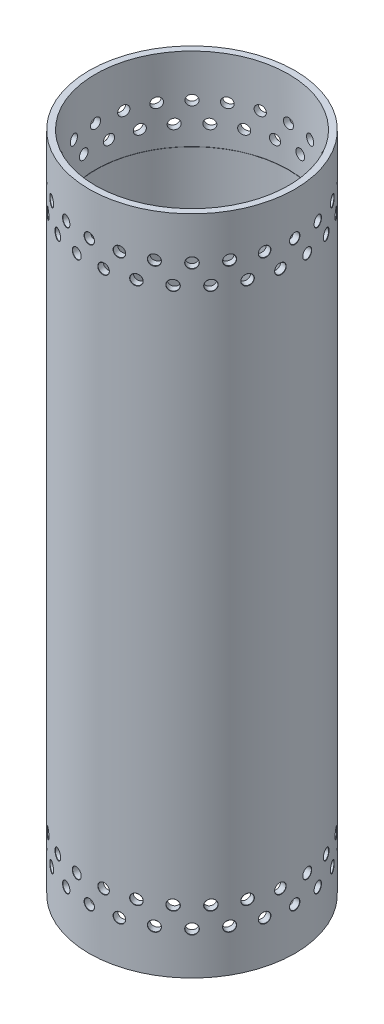
from build123d import *

# Parameters (mm, degrees)
SZKIC1_R                    = 90
SZKIC1_R_2                  = 81.5
DODANIE_WYCI_GNI_CIE1_DEPTH = 560
SZKIC2_R                    = 90
SZKIC2_R_2                  = 87
WYTNIJ_WYCI_GNI_CIE1_DEPTH  = 575.282160614
WYTNIJ_WYCI_GNI_CIE2_START  = -70
SZKIC3_R                    = 81.7
SZKIC3_R_2                  = 81.5
WYTNIJ_WYCI_GNI_CIE2_DEPTH  = 70
SZYK_KO_OWY1_COUNT          = 24


with BuildPart() as part:
    # Szkic1 → Dodanie-wyciągnięcie1 (new body)
    with BuildSketch(Plane(origin=(0, 0, 0), x_dir=(1, 0, 0), z_dir=(0, 1, 0))):
        with Locations(Location((0, 0, 0), (0, 0, 270))):
            Circle(SZKIC1_R)
        with Locations(Location((0, 0, 0), (0, 0, 270))):
            Circle(SZKIC1_R_2, mode=Mode.SUBTRACT)
    extrude(amount=DODANIE_WYCI_GNI_CIE1_DEPTH)

    # Szkic2 → Wytnij-wyciągnięcie1 (cut, through all)
    with BuildSketch(Plane(origin=(0, 560, 0), x_dir=(1, 0, 0), z_dir=(0, 1, 0))):
        Circle(SZKIC2_R)
        with Locations(Location((0, 0, 0), (0, 0, 270))):
            Circle(SZKIC2_R_2, mode=Mode.SUBTRACT)
    extrude(amount=-WYTNIJ_WYCI_GNI_CIE1_DEPTH, mode=Mode.SUBTRACT)

    # Szkic3 → Wytnij-wyciągnięcie2 (cut)
    with BuildSketch(Plane(origin=(0, 560, 0), x_dir=(1, 0, 0), z_dir=(0, 1, 0)).offset(WYTNIJ_WYCI_GNI_CIE2_START)):
        with Locations(Location((0, 0, 0), (0, 0, 270))):
            Circle(SZKIC3_R)
        with Locations(Location((0, 0, 0), (0, 0, 270))):
            Circle(SZKIC3_R_2, mode=Mode.SUBTRACT)
    wytnij_wyci_gni_cie2 = extrude(amount=WYTNIJ_WYCI_GNI_CIE2_DEPTH, mode=Mode.SUBTRACT)

    # Otwór Ø8.5 (8.5)1: read off the stored shape, not the designer's step
    # Otwór Ø8.5 (8.5)1 outline → Otwór Ø8.5 (8.5)1 (revolve, cut)
    with BuildSketch(Plane.XZ.offset(-524)):
        Polygon((0, 81.589336122), (4.25, 81.589336122), (4.25, 86.75), (4.500000084, 87.000000084), (0, 87.000000084), align=None)
    otw_r_8_5_8_5_1 = revolve(axis=Axis((0, 524, 0), (0, 0, 1)), mode=Mode.SUBTRACT)

    # Otwór Ø8.5 (8.5)2: read off the stored shape, not the designer's step
    # Otwór Ø8.5 (8.5)2 outline → Otwór Ø8.5 (8.5)2 (revolve, cut)
    with BuildSketch(Plane(origin=(0, 507, 0), x_dir=(0.9914448613738103, 0, -0.13052619222005205), z_dir=(0, -1, 0))):
        Polygon((0, 81.589323977), (4.25, 81.589323977), (4.25, 86.75), (4.500063259, 87.000063259), (0, 87.000063259), align=None)
    otw_r_8_5_8_5_2 = revolve(axis=Axis((0, 507, 0), (0.13052619222005205, 0, 0.9914448613738103)), mode=Mode.SUBTRACT)

    # Szyk kołowy1: Otwór Ø8.5 (8.5)1, Otwór Ø8.5 (8.5)2 ×24 about axis
    szyk_ko_owy1_axis = Axis((0, 0, 0), (0, 1, 0))
    add([otw_r_8_5_8_5_1.rotate(szyk_ko_owy1_axis, i * 360 / SZYK_KO_OWY1_COUNT) for i in range(1, SZYK_KO_OWY1_COUNT)], mode=Mode.SUBTRACT)
    add([otw_r_8_5_8_5_2.rotate(szyk_ko_owy1_axis, i * 360 / SZYK_KO_OWY1_COUNT) for i in range(1, SZYK_KO_OWY1_COUNT)], mode=Mode.SUBTRACT)

    # Lustro1: Wytnij-wyciągnięcie2, Otwór Ø8.5 (8.5)1, Otwór Ø8.5 (8.5)2 across plane
    add(wytnij_wyci_gni_cie2.mirror(Plane.ZX.offset(280)), mode=Mode.SUBTRACT)
    add(otw_r_8_5_8_5_1.mirror(Plane.ZX.offset(280)), mode=Mode.SUBTRACT)
    add(otw_r_8_5_8_5_2.mirror(Plane.ZX.offset(280)), mode=Mode.SUBTRACT)

    # Lustro1 copy 1 sketch → Lustro1 copy 1 (revolve, cut)
    with BuildSketch(Plane(origin=(0, 36, 0), x_dir=(0.9659258262890683, 0, -0.25881904510252074), z_dir=(0, 1, 0))):
        Polygon((0, -81.589336122), (4.25, -81.589336122), (4.25, -86.75), (4.500000084, -87.000000084), (0, -87.000000084), align=None)
    revolve(axis=Axis((0, 36, 0), (-0.25881904510252074, 0, -0.9659258262890683)), mode=Mode.SUBTRACT)

    # Lustro1 copy 2 sketch → Lustro1 copy 2 (revolve, cut)
    with BuildSketch(Plane(origin=(0, 36, 0), x_dir=(0.8660254037844387, 0, -0.49999999999999994), z_dir=(0, 1, 0))):
        Polygon((0, -81.589336122), (4.25, -81.589336122), (4.25, -86.75), (4.500000084, -87.000000084), (0, -87.000000084), align=None)
    revolve(axis=Axis((0, 36, 0), (-0.49999999999999994, 0, -0.8660254037844387)), mode=Mode.SUBTRACT)

    # Lustro1 copy 3 sketch → Lustro1 copy 3 (revolve, cut)
    with BuildSketch(Plane(origin=(0, 36, 0), x_dir=(0.7071067811865476, 0, -0.7071067811865475), z_dir=(0, 1, 0))):
        Polygon((0, -81.589336122), (4.25, -81.589336122), (4.25, -86.75), (4.500000084, -87.000000084), (0, -87.000000084), align=None)
    revolve(axis=Axis((0, 36, 0), (-0.7071067811865475, 0, -0.7071067811865476)), mode=Mode.SUBTRACT)

    # Lustro1 copy 4 sketch → Lustro1 copy 4 (revolve, cut)
    with BuildSketch(Plane(origin=(0, 36, 0), x_dir=(0.5000000000000001, 0, -0.8660254037844386), z_dir=(0, 1, 0))):
        Polygon((0, -81.589336122), (4.25, -81.589336122), (4.25, -86.75), (4.500000084, -87.000000084), (0, -87.000000084), align=None)
    revolve(axis=Axis((0, 36, 0), (-0.8660254037844386, 0, -0.5000000000000001)), mode=Mode.SUBTRACT)

    # Lustro1 copy 5 sketch → Lustro1 copy 5 (revolve, cut)
    with BuildSketch(Plane(origin=(0, 36, 0), x_dir=(0.25881904510252074, 0, -0.9659258262890683), z_dir=(0, 1, 0))):
        Polygon((0, -81.589336122), (4.25, -81.589336122), (4.25, -86.75), (4.500000084, -87.000000084), (0, -87.000000084), align=None)
    revolve(axis=Axis((0, 36, 0), (-0.9659258262890683, 0, -0.25881904510252074)), mode=Mode.SUBTRACT)

    # Lustro1 copy 6 sketch → Lustro1 copy 6 (revolve, cut)
    with BuildSketch(Plane(origin=(0, 36, 0), x_dir=(0, 0, -1), z_dir=(0, 1, 0))):
        Polygon((0, -81.589336122), (4.25, -81.589336122), (4.25, -86.75), (4.500000084, -87.000000084), (0, -87.000000084), align=None)
    revolve(axis=Axis((0, 36, 0), (-1, 0, 0)), mode=Mode.SUBTRACT)

    # Lustro1 copy 7 sketch → Lustro1 copy 7 (revolve, cut)
    with BuildSketch(Plane(origin=(0, 36, 0), x_dir=(-0.25881904510252085, 0, -0.9659258262890683), z_dir=(0, 1, 0))):
        Polygon((0, -81.589336122), (4.25, -81.589336122), (4.25, -86.75), (4.500000084, -87.000000084), (0, -87.000000084), align=None)
    revolve(axis=Axis((0, 36, 0), (-0.9659258262890683, 0, 0.25881904510252085)), mode=Mode.SUBTRACT)

    # Lustro1 copy 8 sketch → Lustro1 copy 8 (revolve, cut)
    with BuildSketch(Plane(origin=(0, 36, 0), x_dir=(-0.4999999999999998, 0, -0.8660254037844387), z_dir=(0, 1, 0))):
        Polygon((0, -81.589336122), (4.25, -81.589336122), (4.25, -86.75), (4.500000084, -87.000000084), (0, -87.000000084), align=None)
    revolve(axis=Axis((0, 36, 0), (-0.8660254037844387, 0, 0.4999999999999998)), mode=Mode.SUBTRACT)

    # Lustro1 copy 9 sketch → Lustro1 copy 9 (revolve, cut)
    with BuildSketch(Plane(origin=(0, 36, 0), x_dir=(-0.7071067811865475, 0, -0.7071067811865476), z_dir=(0, 1, 0))):
        Polygon((0, -81.589336122), (4.25, -81.589336122), (4.25, -86.75), (4.500000084, -87.000000084), (0, -87.000000084), align=None)
    revolve(axis=Axis((0, 36, 0), (-0.7071067811865476, 0, 0.7071067811865475)), mode=Mode.SUBTRACT)

    # Lustro1 copy 10 sketch → Lustro1 copy 10 (revolve, cut)
    with BuildSketch(Plane(origin=(0, 36, 0), x_dir=(-0.8660254037844387, 0, -0.49999999999999994), z_dir=(0, 1, 0))):
        Polygon((0, -81.589336122), (4.25, -81.589336122), (4.25, -86.75), (4.500000084, -87.000000084), (0, -87.000000084), align=None)
    revolve(axis=Axis((0, 36, 0), (-0.49999999999999994, 0, 0.8660254037844387)), mode=Mode.SUBTRACT)

    # Lustro1 copy 11 sketch → Lustro1 copy 11 (revolve, cut)
    with BuildSketch(Plane(origin=(0, 36, 0), x_dir=(-0.9659258262890682, 0, -0.258819045102521), z_dir=(0, 1, 0))):
        Polygon((0, -81.589336122), (4.25, -81.589336122), (4.25, -86.75), (4.500000084, -87.000000084), (0, -87.000000084), align=None)
    revolve(axis=Axis((0, 36, 0), (-0.258819045102521, 0, 0.9659258262890682)), mode=Mode.SUBTRACT)

    # Lustro1 copy 12 sketch → Lustro1 copy 12 (revolve, cut)
    with BuildSketch(Plane(origin=(0, 36, 0), x_dir=(-1, 0, 0), z_dir=(0, 1, 0))):
        Polygon((0, -81.589336122), (4.25, -81.589336122), (4.25, -86.75), (4.500000084, -87.000000084), (0, -87.000000084), align=None)
    revolve(axis=Axis((0, 36, 0), (0, 0, 1)), mode=Mode.SUBTRACT)

    # Lustro1 copy 13 sketch → Lustro1 copy 13 (revolve, cut)
    with BuildSketch(Plane(origin=(0, 36, 0), x_dir=(-0.9659258262890683, 0, 0.2588190451025208), z_dir=(0, 1, 0))):
        Polygon((0, -81.589336122), (4.25, -81.589336122), (4.25, -86.75), (4.500000084, -87.000000084), (0, -87.000000084), align=None)
    revolve(axis=Axis((0, 36, 0), (0.2588190451025208, 0, 0.9659258262890683)), mode=Mode.SUBTRACT)

    # Lustro1 copy 14 sketch → Lustro1 copy 14 (revolve, cut)
    with BuildSketch(Plane(origin=(0, 36, 0), x_dir=(-0.8660254037844386, 0, 0.5000000000000001), z_dir=(0, 1, 0))):
        Polygon((0, -81.589336122), (4.25, -81.589336122), (4.25, -86.75), (4.500000084, -87.000000084), (0, -87.000000084), align=None)
    revolve(axis=Axis((0, 36, 0), (0.5000000000000001, 0, 0.8660254037844386)), mode=Mode.SUBTRACT)

    # Lustro1 copy 15 sketch → Lustro1 copy 15 (revolve, cut)
    with BuildSketch(Plane(origin=(0, 36, 0), x_dir=(-0.7071067811865477, 0, 0.7071067811865475), z_dir=(0, 1, 0))):
        Polygon((0, -81.589336122), (4.25, -81.589336122), (4.25, -86.75), (4.500000084, -87.000000084), (0, -87.000000084), align=None)
    revolve(axis=Axis((0, 36, 0), (0.7071067811865475, 0, 0.7071067811865477)), mode=Mode.SUBTRACT)

    # Lustro1 copy 16 sketch → Lustro1 copy 16 (revolve, cut)
    with BuildSketch(Plane(origin=(0, 36, 0), x_dir=(-0.5000000000000004, 0, 0.8660254037844384), z_dir=(0, 1, 0))):
        Polygon((0, -81.589336122), (4.25, -81.589336122), (4.25, -86.75), (4.500000084, -87.000000084), (0, -87.000000084), align=None)
    revolve(axis=Axis((0, 36, 0), (0.8660254037844384, 0, 0.5000000000000004)), mode=Mode.SUBTRACT)

    # Lustro1 copy 17 sketch → Lustro1 copy 17 (revolve, cut)
    with BuildSketch(Plane(origin=(0, 36, 0), x_dir=(-0.25881904510252063, 0, 0.9659258262890683), z_dir=(0, 1, 0))):
        Polygon((0, -81.589336122), (4.25, -81.589336122), (4.25, -86.75), (4.500000084, -87.000000084), (0, -87.000000084), align=None)
    revolve(axis=Axis((0, 36, 0), (0.9659258262890683, 0, 0.25881904510252063)), mode=Mode.SUBTRACT)

    # Lustro1 copy 18 sketch → Lustro1 copy 18 (revolve, cut)
    with BuildSketch(Plane.ZX.offset(36)):
        Polygon((0, -81.589336122), (4.25, -81.589336122), (4.25, -86.75), (4.500000084, -87.000000084), (0, -87.000000084), align=None)
    revolve(axis=Axis((0, 36, 0), (1, 0, 0)), mode=Mode.SUBTRACT)

    # Lustro1 copy 19 sketch → Lustro1 copy 19 (revolve, cut)
    with BuildSketch(Plane(origin=(0, 36, 0), x_dir=(0.2588190451025203, 0, 0.9659258262890684), z_dir=(0, 1, 0))):
        Polygon((0, -81.589336122), (4.25, -81.589336122), (4.25, -86.75), (4.500000084, -87.000000084), (0, -87.000000084), align=None)
    revolve(axis=Axis((0, 36, 0), (0.9659258262890684, 0, -0.2588190451025203)), mode=Mode.SUBTRACT)

    # Lustro1 copy 20 sketch → Lustro1 copy 20 (revolve, cut)
    with BuildSketch(Plane(origin=(0, 36, 0), x_dir=(0.5000000000000001, 0, 0.8660254037844386), z_dir=(0, 1, 0))):
        Polygon((0, -81.589336122), (4.25, -81.589336122), (4.25, -86.75), (4.500000084, -87.000000084), (0, -87.000000084), align=None)
    revolve(axis=Axis((0, 36, 0), (0.8660254037844386, 0, -0.5000000000000001)), mode=Mode.SUBTRACT)

    # Lustro1 copy 21 sketch → Lustro1 copy 21 (revolve, cut)
    with BuildSketch(Plane(origin=(0, 36, 0), x_dir=(0.7071067811865474, 0, 0.7071067811865477), z_dir=(0, 1, 0))):
        Polygon((0, -81.589336122), (4.25, -81.589336122), (4.25, -86.75), (4.500000084, -87.000000084), (0, -87.000000084), align=None)
    revolve(axis=Axis((0, 36, 0), (0.7071067811865477, 0, -0.7071067811865474)), mode=Mode.SUBTRACT)

    # Lustro1 copy 22 sketch → Lustro1 copy 22 (revolve, cut)
    with BuildSketch(Plane(origin=(0, 36, 0), x_dir=(0.8660254037844384, 0, 0.5000000000000004), z_dir=(0, 1, 0))):
        Polygon((0, -81.589336122), (4.25, -81.589336122), (4.25, -86.75), (4.500000084, -87.000000084), (0, -87.000000084), align=None)
    revolve(axis=Axis((0, 36, 0), (0.5000000000000004, 0, -0.8660254037844384)), mode=Mode.SUBTRACT)

    # Lustro1 copy 23 sketch → Lustro1 copy 23 (revolve, cut)
    with BuildSketch(Plane(origin=(0, 36, 0), x_dir=(0.9659258262890683, 0, 0.2588190451025207), z_dir=(0, 1, 0))):
        Polygon((0, -81.589336122), (4.25, -81.589336122), (4.25, -86.75), (4.500000084, -87.000000084), (0, -87.000000084), align=None)
    revolve(axis=Axis((0, 36, 0), (0.2588190451025207, 0, -0.9659258262890683)), mode=Mode.SUBTRACT)

    # Lustro1 copy 24 sketch → Lustro1 copy 24 (revolve, cut)
    with BuildSketch(Plane(origin=(0, 53, 0), x_dir=(0.9238795325112865, 0, -0.38268343236509017), z_dir=(0, 1, 0))):
        Polygon((0, -81.589323977), (4.25, -81.589323977), (4.25, -86.75), (4.500063259, -87.000063259), (0, -87.000063259), align=None)
    revolve(axis=Axis((0, 53, 0), (-0.38268343236509017, 0, -0.9238795325112865)), mode=Mode.SUBTRACT)

    # Lustro1 copy 25 sketch → Lustro1 copy 25 (revolve, cut)
    with BuildSketch(Plane(origin=(0, 53, 0), x_dir=(0.7933533402912349, 0, -0.6087614290087209), z_dir=(0, 1, 0))):
        Polygon((0, -81.589323977), (4.25, -81.589323977), (4.25, -86.75), (4.500063259, -87.000063259), (0, -87.000063259), align=None)
    revolve(axis=Axis((0, 53, 0), (-0.6087614290087209, 0, -0.7933533402912349)), mode=Mode.SUBTRACT)

    # Lustro1 copy 26 sketch → Lustro1 copy 26 (revolve, cut)
    with BuildSketch(Plane(origin=(0, 53, 0), x_dir=(0.6087614290087202, 0, -0.7933533402912353), z_dir=(0, 1, 0))):
        Polygon((0, -81.589323977), (4.25, -81.589323977), (4.25, -86.75), (4.500063259, -87.000063259), (0, -87.000063259), align=None)
    revolve(axis=Axis((0, 53, 0), (-0.7933533402912353, 0, -0.6087614290087202)), mode=Mode.SUBTRACT)

    # Lustro1 copy 27 sketch → Lustro1 copy 27 (revolve, cut)
    with BuildSketch(Plane(origin=(0, 53, 0), x_dir=(0.3826834323650894, 0, -0.9238795325112868), z_dir=(0, 1, 0))):
        Polygon((0, -81.589323977), (4.25, -81.589323977), (4.25, -86.75), (4.500063259, -87.000063259), (0, -87.000063259), align=None)
    revolve(axis=Axis((0, 53, 0), (-0.9238795325112868, 0, -0.3826834323650894)), mode=Mode.SUBTRACT)

    # Lustro1 copy 28 sketch → Lustro1 copy 28 (revolve, cut)
    with BuildSketch(Plane(origin=(0, 53, 0), x_dir=(0.13052619222005113, 0, -0.9914448613738105), z_dir=(0, 1, 0))):
        Polygon((0, -81.589323977), (4.25, -81.589323977), (4.25, -86.75), (4.500063259, -87.000063259), (0, -87.000063259), align=None)
    revolve(axis=Axis((0, 53, 0), (-0.9914448613738105, 0, -0.13052619222005113)), mode=Mode.SUBTRACT)

    # Lustro1 copy 29 sketch → Lustro1 copy 29 (revolve, cut)
    with BuildSketch(Plane(origin=(0, 53, 0), x_dir=(-0.130526192220052, 0, -0.9914448613738103), z_dir=(0, 1, 0))):
        Polygon((0, -81.589323977), (4.25, -81.589323977), (4.25, -86.75), (4.500063259, -87.000063259), (0, -87.000063259), align=None)
    revolve(axis=Axis((0, 53, 0), (-0.9914448613738103, 0, 0.130526192220052)), mode=Mode.SUBTRACT)

    # Lustro1 copy 30 sketch → Lustro1 copy 30 (revolve, cut)
    with BuildSketch(Plane(origin=(0, 53, 0), x_dir=(-0.3826834323650902, 0, -0.9238795325112865), z_dir=(0, 1, 0))):
        Polygon((0, -81.589323977), (4.25, -81.589323977), (4.25, -86.75), (4.500063259, -87.000063259), (0, -87.000063259), align=None)
    revolve(axis=Axis((0, 53, 0), (-0.9238795325112865, 0, 0.3826834323650902)), mode=Mode.SUBTRACT)

    # Lustro1 copy 31 sketch → Lustro1 copy 31 (revolve, cut)
    with BuildSketch(Plane(origin=(0, 53, 0), x_dir=(-0.6087614290087208, 0, -0.7933533402912349), z_dir=(0, 1, 0))):
        Polygon((0, -81.589323977), (4.25, -81.589323977), (4.25, -86.75), (4.500063259, -87.000063259), (0, -87.000063259), align=None)
    revolve(axis=Axis((0, 53, 0), (-0.7933533402912349, 0, 0.6087614290087208)), mode=Mode.SUBTRACT)

    # Lustro1 copy 32 sketch → Lustro1 copy 32 (revolve, cut)
    with BuildSketch(Plane(origin=(0, 53, 0), x_dir=(-0.7933533402912353, 0, -0.6087614290087202), z_dir=(0, 1, 0))):
        Polygon((0, -81.589323977), (4.25, -81.589323977), (4.25, -86.75), (4.500063259, -87.000063259), (0, -87.000063259), align=None)
    revolve(axis=Axis((0, 53, 0), (-0.6087614290087202, 0, 0.7933533402912353)), mode=Mode.SUBTRACT)

    # Lustro1 copy 33 sketch → Lustro1 copy 33 (revolve, cut)
    with BuildSketch(Plane(origin=(0, 53, 0), x_dir=(-0.923879532511287, 0, -0.3826834323650892), z_dir=(0, 1, 0))):
        Polygon((0, -81.589323977), (4.25, -81.589323977), (4.25, -86.75), (4.500063259, -87.000063259), (0, -87.000063259), align=None)
    revolve(axis=Axis((0, 53, 0), (-0.3826834323650892, 0, 0.923879532511287)), mode=Mode.SUBTRACT)

    # Lustro1 copy 34 sketch → Lustro1 copy 34 (revolve, cut)
    with BuildSketch(Plane(origin=(0, 53, 0), x_dir=(-0.9914448613738104, 0, -0.13052619222005135), z_dir=(0, 1, 0))):
        Polygon((0, -81.589323977), (4.25, -81.589323977), (4.25, -86.75), (4.500063259, -87.000063259), (0, -87.000063259), align=None)
    revolve(axis=Axis((0, 53, 0), (-0.13052619222005135, 0, 0.9914448613738104)), mode=Mode.SUBTRACT)

    # Lustro1 copy 35 sketch → Lustro1 copy 35 (revolve, cut)
    with BuildSketch(Plane(origin=(0, 53, 0), x_dir=(-0.9914448613738103, 0, 0.13052619222005193), z_dir=(0, 1, 0))):
        Polygon((0, -81.589323977), (4.25, -81.589323977), (4.25, -86.75), (4.500063259, -87.000063259), (0, -87.000063259), align=None)
    revolve(axis=Axis((0, 53, 0), (0.13052619222005193, 0, 0.9914448613738103)), mode=Mode.SUBTRACT)

    # Lustro1 copy 36 sketch → Lustro1 copy 36 (revolve, cut)
    with BuildSketch(Plane(origin=(0, 53, 0), x_dir=(-0.9238795325112865, 0, 0.3826834323650902), z_dir=(0, 1, 0))):
        Polygon((0, -81.589323977), (4.25, -81.589323977), (4.25, -86.75), (4.500063259, -87.000063259), (0, -87.000063259), align=None)
    revolve(axis=Axis((0, 53, 0), (0.3826834323650902, 0, 0.9238795325112865)), mode=Mode.SUBTRACT)

    # Lustro1 copy 37 sketch → Lustro1 copy 37 (revolve, cut)
    with BuildSketch(Plane(origin=(0, 53, 0), x_dir=(-0.7933533402912348, 0, 0.6087614290087211), z_dir=(0, 1, 0))):
        Polygon((0, -81.589323977), (4.25, -81.589323977), (4.25, -86.75), (4.500063259, -87.000063259), (0, -87.000063259), align=None)
    revolve(axis=Axis((0, 53, 0), (0.6087614290087211, 0, 0.7933533402912348)), mode=Mode.SUBTRACT)

    # Lustro1 copy 38 sketch → Lustro1 copy 38 (revolve, cut)
    with BuildSketch(Plane(origin=(0, 53, 0), x_dir=(-0.6087614290087203, 0, 0.7933533402912353), z_dir=(0, 1, 0))):
        Polygon((0, -81.589323977), (4.25, -81.589323977), (4.25, -86.75), (4.500063259, -87.000063259), (0, -87.000063259), align=None)
    revolve(axis=Axis((0, 53, 0), (0.7933533402912353, 0, 0.6087614290087203)), mode=Mode.SUBTRACT)

    # Lustro1 copy 39 sketch → Lustro1 copy 39 (revolve, cut)
    with BuildSketch(Plane(origin=(0, 53, 0), x_dir=(-0.3826834323650898, 0, 0.9238795325112867), z_dir=(0, 1, 0))):
        Polygon((0, -81.589323977), (4.25, -81.589323977), (4.25, -86.75), (4.500063259, -87.000063259), (0, -87.000063259), align=None)
    revolve(axis=Axis((0, 53, 0), (0.9238795325112867, 0, 0.3826834323650898)), mode=Mode.SUBTRACT)

    # Lustro1 copy 40 sketch → Lustro1 copy 40 (revolve, cut)
    with BuildSketch(Plane(origin=(0, 53, 0), x_dir=(-0.13052619222005102, 0, 0.9914448613738104), z_dir=(0, 1, 0))):
        Polygon((0, -81.589323977), (4.25, -81.589323977), (4.25, -86.75), (4.500063259, -87.000063259), (0, -87.000063259), align=None)
    revolve(axis=Axis((0, 53, 0), (0.9914448613738104, 0, 0.13052619222005102)), mode=Mode.SUBTRACT)

    # Lustro1 copy 41 sketch → Lustro1 copy 41 (revolve, cut)
    with BuildSketch(Plane(origin=(0, 53, 0), x_dir=(0.13052619222005185, 0, 0.9914448613738103), z_dir=(0, 1, 0))):
        Polygon((0, -81.589323977), (4.25, -81.589323977), (4.25, -86.75), (4.500063259, -87.000063259), (0, -87.000063259), align=None)
    revolve(axis=Axis((0, 53, 0), (0.9914448613738103, 0, -0.13052619222005185)), mode=Mode.SUBTRACT)

    # Lustro1 copy 42 sketch → Lustro1 copy 42 (revolve, cut)
    with BuildSketch(Plane(origin=(0, 53, 0), x_dir=(0.3826834323650897, 0, 0.9238795325112867), z_dir=(0, 1, 0))):
        Polygon((0, -81.589323977), (4.25, -81.589323977), (4.25, -86.75), (4.500063259, -87.000063259), (0, -87.000063259), align=None)
    revolve(axis=Axis((0, 53, 0), (0.9238795325112867, 0, -0.3826834323650897)), mode=Mode.SUBTRACT)

    # Lustro1 copy 43 sketch → Lustro1 copy 43 (revolve, cut)
    with BuildSketch(Plane(origin=(0, 53, 0), x_dir=(0.6087614290087211, 0, 0.7933533402912348), z_dir=(0, 1, 0))):
        Polygon((0, -81.589323977), (4.25, -81.589323977), (4.25, -86.75), (4.500063259, -87.000063259), (0, -87.000063259), align=None)
    revolve(axis=Axis((0, 53, 0), (0.7933533402912348, 0, -0.6087614290087211)), mode=Mode.SUBTRACT)

    # Lustro1 copy 44 sketch → Lustro1 copy 44 (revolve, cut)
    with BuildSketch(Plane(origin=(0, 53, 0), x_dir=(0.7933533402912352, 0, 0.6087614290087203), z_dir=(0, 1, 0))):
        Polygon((0, -81.589323977), (4.25, -81.589323977), (4.25, -86.75), (4.500063259, -87.000063259), (0, -87.000063259), align=None)
    revolve(axis=Axis((0, 53, 0), (0.6087614290087203, 0, -0.7933533402912352)), mode=Mode.SUBTRACT)

    # Lustro1 copy 45 sketch → Lustro1 copy 45 (revolve, cut)
    with BuildSketch(Plane(origin=(0, 53, 0), x_dir=(0.9238795325112867, 0, 0.3826834323650898), z_dir=(0, 1, 0))):
        Polygon((0, -81.589323977), (4.25, -81.589323977), (4.25, -86.75), (4.500063259, -87.000063259), (0, -87.000063259), align=None)
    revolve(axis=Axis((0, 53, 0), (0.3826834323650898, 0, -0.9238795325112867)), mode=Mode.SUBTRACT)

    # Lustro1 copy 46 sketch → Lustro1 copy 46 (revolve, cut)
    with BuildSketch(Plane(origin=(0, 53, 0), x_dir=(0.9914448613738105, 0, 0.13052619222005107), z_dir=(0, 1, 0))):
        Polygon((0, -81.589323977), (4.25, -81.589323977), (4.25, -86.75), (4.500063259, -87.000063259), (0, -87.000063259), align=None)
    revolve(axis=Axis((0, 53, 0), (0.13052619222005107, 0, -0.9914448613738105)), mode=Mode.SUBTRACT)


solid = part.part
